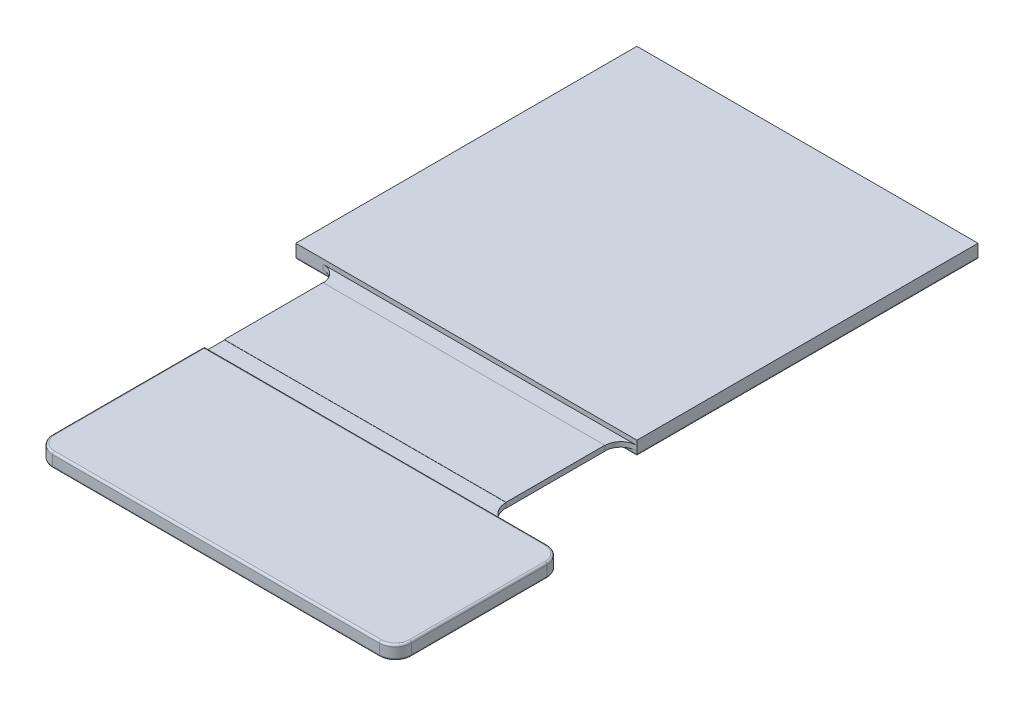
from build123d import *

# Parameters (mm, degrees)
BOSS_EXTRUDE1_DEPTH = 0.35
FILLET1_R           = 0.4
FILLET2_R           = 0.5
SKETCH4_W           = 8.5
SKETCH4_H           = 3.36
CUT_EXTRUDE1_DEPTH  = 0.115
SKETCH5_W           = 8.5
SKETCH5_H           = 3.36
CUT_EXTRUDE2_DEPTH  = 0.115
FILLET3_R           = 0.05
SKETCH8_W           = 7.02
SKETCH8_H           = 2.46
BOSS_EXTRUDE2_DEPTH = 0.005
SKETCH9_W           = 7.02
SKETCH9_H           = 2.46
BOSS_EXTRUDE3_DEPTH = 0.005
SKETCH10_W          = 0.5
SKETCH10_H          = 0.12
CUT_EXTRUDE3_DEPTH  = 0.005


with BuildPart() as part:
    # Sketch3 → Boss-Extrude1 (new body)
    with BuildSketch(Plane(origin=(0, 0, 0), x_dir=(1, 0, 0), z_dir=(0, 1, 0))):
        Polygon((-4.25, -4.25), (-3.17, -4.25), (-3.17, -11.79), (5.77, -11.79), (5.77, -7.61), (3.85, -7.61), (3.85, -4.25), (4.25, -4.25), (4.25, 4.25), (-4.25, 4.25), align=None)
    extrude(amount=BOSS_EXTRUDE1_DEPTH)

    # Fillet1
    fillet1_edges = [part.edges().sort_by_distance(p)[0] for p in [
        (5.77, 0.175, 11.79),
        (-3.17, 0.175, 11.79),
        (-3.17, 0.175, 4.25),
        (3.85, 0.175, 4.25),
        (5.77, 0.175, 7.61),
    ]]
    fillet(fillet1_edges, radius=FILLET1_R - 0.0001)  # a hair under: the kernel refuses the full size

    # Fillet2
    fillet2_edges = [part.edges().sort_by_distance(p)[0] for p in [
        (3.85, 0.175, 7.61),
    ]]
    fillet(fillet2_edges, radius=FILLET2_R)

    # Sketch4 → Cut-Extrude1 (cut)
    with BuildSketch(Plane(origin=(0, 0.35, 0), x_dir=(1, 0, 0), z_dir=(0, 1, 0))):
        with Locations((0, -5.93)):
            Rectangle(SKETCH4_W, SKETCH4_H)
    extrude(amount=-CUT_EXTRUDE1_DEPTH, mode=Mode.SUBTRACT)

    # Sketch5 → Cut-Extrude2 (cut)
    with BuildSketch(Plane.XZ):
        with Locations((0, 5.93)):
            Rectangle(SKETCH5_W, SKETCH5_H)
    extrude(amount=-CUT_EXTRUDE2_DEPTH, mode=Mode.SUBTRACT)

    # Fillet3
    fillet3_edges = [part.edges().sort_by_distance(p)[0] for p in [
        (-3.17, 0, 9.50005),
        (0.54, 0, 7.61),
        (4.25, 0, 7.604948974),
        (0, 0, 4.25),
        (-4.25, 0, 0),
        (0, 0, -4.25),
        (4.25, 0, 0),
        (4.86005, 0, 7.61),
        (4.86005, 0.35, 7.61),
        (5.77, 0, 9.7),
        (1.3, 0, 11.79),
        (-3.052872002, 0, 11.672872002),
        (5.652872002, 0, 11.672872002),
        (5.652872002, 0, 7.727127998),
        (5.77, 0.35, 9.7),
        (1.3, 0.35, 11.79),
        (-3.052872002, 0.35, 11.672872002),
        (5.652872002, 0.35, 11.672872002),
        (5.652872002, 0.35, 7.727127998),
        (4.299745519, 0.35, 7.607468077),
        (-3.17, 0.35, 9.50005),
        (0.54, 0.35, 7.61),
        (4.25, 0.35, 7.604948974),
        (4.299745519, 0, 7.607468077),
    ]]
    fillet(fillet3_edges, radius=FILLET3_R)

    # Sketch8 → Boss-Extrude2 (add)
    with BuildSketch(Plane(origin=(0, 0.235, 0), x_dir=(1, 0, 0), z_dir=(0, 1, 0))):
        with Locations((0.34, -5.88)):
            Rectangle(SKETCH8_W, SKETCH8_H)
    extrude(amount=BOSS_EXTRUDE2_DEPTH)

    # Sketch9 → Boss-Extrude3 (add)
    with BuildSketch(Plane.XZ.offset(-0.115)):
        with Locations((0.34, 5.88)):
            Rectangle(SKETCH9_W, SKETCH9_H)
    extrude(amount=BOSS_EXTRUDE3_DEPTH)

    # Sketch10 → Cut-Extrude3 (cut)
    with BuildSketch(Plane.ZY.offset(3.17)):
        with Locations((7.36, 0.175)):
            Rectangle(SKETCH10_W, SKETCH10_H)
    extrude(amount=-CUT_EXTRUDE3_DEPTH, mode=Mode.SUBTRACT)


solid = part.part
